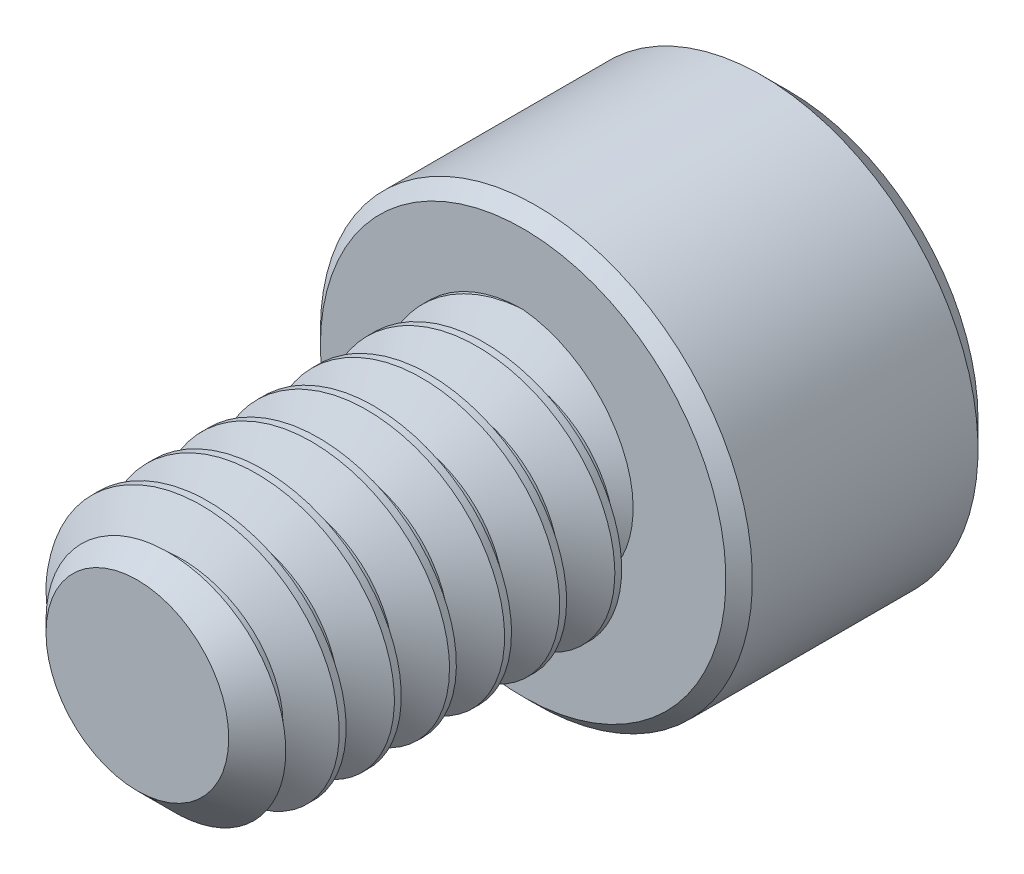
from build123d import *

# Parameters (mm, degrees)
SKETCH1_R          = 1.0922
EXTRUDE1_DEPTH     = 3.175
CHAMFER3_SIZE      = 0.340178571
CUT_SWEEP1_PITCH   = 0.453571429
SKETCH6_R          = 1.778
EXTRUDE2_DEPTH     = 2.1844
CUT_EXTRUDE1_DEPTH = 1.48828125
SKETCH8_R          = 1.14567944
CUT_EXTRUDE2_DEPTH = 0.21844
CUT_EXTRUDE2_DRAFT = -45
CHAMFER1_SIZE      = 0.21844
CHAMFER2_SIZE      = 0.10922


with BuildPart() as part:
    # Sketch1 → Extrude1 (new body)
    with BuildSketch(Plane.XY):
        Circle(SKETCH1_R)
    extrude(amount=-EXTRUDE1_DEPTH)

    # Chamfer3
    chamfer3_edges = [part.edges().sort_by_distance(p)[0] for p in [
        (-1.0922, 0, 0),
    ]]
    chamfer(chamfer3_edges, length=CHAMFER3_SIZE)

    # Cut-Sweep1: the profile of Sketch3 profile screwed along a right-hand helix of 8 turns, 6 arcs to a turn; built about Z, then put on its axis
    cut_sweep1_z = Axis((0, 0, 0), (0, 0, 1))
    cut_sweep1_corners = [(1.0925, 0, -0.397048205), (0.797596715, 0, -0.226785714), (0.797596715, 0, -0.170089286), (1.0925, 0, 0.000173205)]
    with BuildLine(mode=Mode.PRIVATE) as cut_sweep1_profile:
        Line(cut_sweep1_corners[0], cut_sweep1_corners[1])
        Line(cut_sweep1_corners[1], cut_sweep1_corners[2])
        Line(cut_sweep1_corners[2], cut_sweep1_corners[3])
        Line(cut_sweep1_corners[3], cut_sweep1_corners[0])
    cut_sweep1_cap = Face(cut_sweep1_profile.wire())
    cut_sweep1_turn_angles = [0, 30, 60, 90, 120, 150, 180, 210, 240, 270, 300, 330, 360]
    cut_sweep1_turn_weights = [1, 0.8660254037844387, 1, 0.8660254037844387, 1, 0.8660254037844387, 1, 0.8660254037844387, 1, 0.8660254037844387, 1, 0.8660254037844387, 1]
    cut_sweep1_turn_rails = [Edge.make_bspline([Vector(p[0], p[1], 0).rotate(cut_sweep1_z, cut_sweep1_turn_angles[k]) / cut_sweep1_turn_weights[k] + Vector(0, 0, p[2] + CUT_SWEEP1_PITCH * cut_sweep1_turn_angles[k] / 360) for k in range(13)], [0, 0, 0, 1, 1, 2, 2, 3, 3, 4, 4, 5, 5, 6, 6, 6], 2, cut_sweep1_turn_weights) for p in cut_sweep1_corners]
    cut_sweep1_turn_sides = [Face.make_surface_from_curves(cut_sweep1_turn_rails[p[0]], cut_sweep1_turn_rails[p[1]]) for p in [(0, 1), (1, 2), (2, 3), (3, 0)]]
    cut_sweep1 = Plane(origin=(0, 0, 0), x_dir=(0, 1, 0), z_dir=(0, 0, -1)) * Solid(Shell([*[p.moved(Location((0, 0, CUT_SWEEP1_PITCH * i))) for i in range(8) for p in cut_sweep1_turn_sides], cut_sweep1_cap, cut_sweep1_cap.rotate(cut_sweep1_z, 2880).moved(Location((0, 0, CUT_SWEEP1_PITCH * 2880 / 360)))]))
    add(cut_sweep1, mode=Mode.SUBTRACT)

    # Sketch6 → Extrude2 (add)
    with BuildSketch(Plane(origin=(0, 0, -3.175), x_dir=(-1, 0, 0), z_dir=(0, 0, -1))):
        Circle(SKETCH6_R)
    extrude(amount=EXTRUDE2_DEPTH)

    # Sketch7 → Cut-Extrude1 (cut)
    with BuildSketch(Plane(origin=(0, 0, -5.3594), x_dir=(-1, 0, 0), z_dir=(0, 0, -1))):
        Polygon((0, 1.14567944), (-0.9921875, 0.57283972), (-0.9921875, -0.57283972), (0, -1.14567944), (0.9921875, -0.57283972), (0.9921875, 0.57283972), align=None)
    extrude(amount=-CUT_EXTRUDE1_DEPTH, mode=Mode.SUBTRACT)


with BuildPart() as cut_extrude2_tool:
    # Sketch8 → Cut-Extrude2 (with draft: the straight prism first)
    with BuildSketch(Plane(origin=(0, 0, -5.3594), x_dir=(-1, 0, 0), z_dir=(0, 0, -1))):
        Circle(SKETCH8_R)
    extrude(amount=-CUT_EXTRUDE2_DEPTH)
    # Cut-Extrude2: the draft: its side faces are tilted about the plane it starts from
    cut_extrude2_sides = [cut_extrude2_tool.faces().sort_by_distance(p)[0] for p in [
        (1.14567944, 0, -5.25018),
    ]]
    draft(cut_extrude2_sides, Plane(origin=(0, 0, -5.3594), x_dir=(-1, 0, 0), z_dir=(0, 0, -1)), CUT_EXTRUDE2_DRAFT)


with BuildPart() as part_1:
    add(part.part)

    # Cut-Extrude2: cut by cut_extrude2_tool
    add(cut_extrude2_tool.part, mode=Mode.SUBTRACT)

    # Chamfer1
    chamfer1_edges = [part_1.edges().sort_by_distance(p)[0] for p in [
        (1.778, 0, -5.3594),
    ]]
    chamfer(chamfer1_edges, length=CHAMFER1_SIZE)

    # Chamfer2
    chamfer2_edges = [part_1.edges().sort_by_distance(p)[0] for p in [
        (1.778, 0, -3.175),
    ]]
    chamfer(chamfer2_edges, length=CHAMFER2_SIZE)


solid = part_1.part
